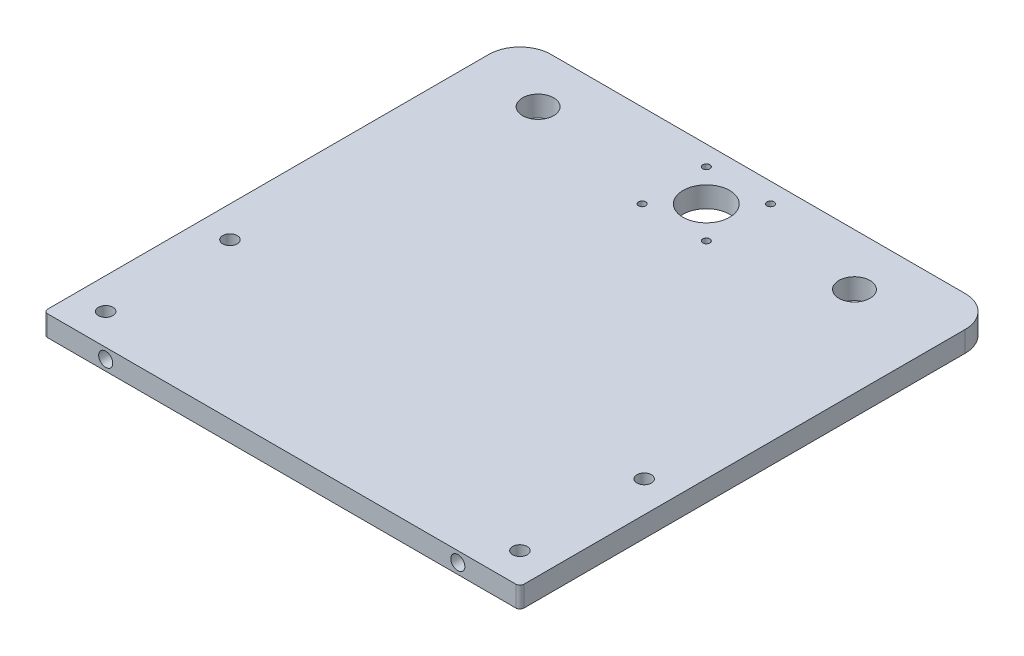
from build123d import *

# Parameters (mm, degrees)
SKIZZE1_W                                 = 230
SKIZZE1_H                                 = 230
AUFSATZ_LINEAR_AUSTRAGEN1_DEPTH           = 10
F_15_0_15_DURCHMESSER_BOHRUNG1_D          = 15
F_3_4_3_4_DURCHMESSER_BOHRUNG1_AT_2_COUNT = 2
F_3_4_3_4_DURCHMESSER_BOHRUNG1_AT_2_PITCH = 31
F_3_4_3_4_DURCHMESSER_BOHRUNG1_AT_3_COUNT = 2
F_3_4_3_4_DURCHMESSER_BOHRUNG1_AT_3_PITCH = 31
F_3_4_3_4_DURCHMESSER_BOHRUNG1_AT_4_COUNT = 2
F_3_4_3_4_DURCHMESSER_BOHRUNG1_AT_4_PITCH = 43.840620434
F_22_5_22_5_DURCHMESSER_BOHRUNG1_D        = 22.5
F_7_0_7_DURCHMESSER_BOHRUNG1_D            = 7
VERRUNDUNG5_R                             = 15
VERRUNDUNG6_R                             = 2
M8_GEWINDEBOHRUNG1_D                      = 6.8
M8_GEWINDEBOHRUNG1_DEPTH                  = 30
M8_GEWINDEBOHRUNG1_TIP                    = 2.042926105


with BuildPart() as part:
    # Skizze1 → Aufsatz-Linear austragen1 (new body)
    with BuildSketch(Plane(origin=(0, 0, 0), x_dir=(1, 0, 0), z_dir=(0, 1, 0))):
        Rectangle(SKIZZE1_W, SKIZZE1_H)
    extrude(amount=AUFSATZ_LINEAR_AUSTRAGEN1_DEPTH)

    # Ø15.0 (15) Durchmesser Bohrung1 (through all)
    with Locations(Plane(origin=(0, 10, 0), x_dir=(1, 0, 0), z_dir=(0, 1, 0))):
        with Locations((-81.223039609, 90), (71.525536654, 90)):
            Hole(F_15_0_15_DURCHMESSER_BOHRUNG1_D / 2)

    # Skizze9 → Ø3.4 (3.4) Durchmesser Bohrung1 (revolve, cut)
    with BuildSketch(Plane(origin=(-15.5, 10, -105.5), x_dir=(0, 0, 1), z_dir=(1, 0, 0))):
        Polygon((0, 0), (0, 10), (1.725, 10), (1.7, 9.975), (1.7, 0.025), (1.725, 0), align=None)
    f_3_4_3_4_durchmesser_bohrung1 = revolve(axis=Axis((-15.5, 16.35, -105.5), (0, -1, 0)), mode=Mode.SUBTRACT)

    # Ø3.4 (3.4) Durchmesser Bohrung1 at 2: Ø3.4 (3.4) Durchmesser Bohrung1 ×2
    with Locations(*[(i * F_3_4_3_4_DURCHMESSER_BOHRUNG1_AT_2_PITCH, 0, 0) for i in range(1, F_3_4_3_4_DURCHMESSER_BOHRUNG1_AT_2_COUNT)]):
        add(f_3_4_3_4_durchmesser_bohrung1, mode=Mode.SUBTRACT)

    # Ø3.4 (3.4) Durchmesser Bohrung1 at 3: Ø3.4 (3.4) Durchmesser Bohrung1 ×2
    with Locations(*[(0, 0, i * F_3_4_3_4_DURCHMESSER_BOHRUNG1_AT_3_PITCH) for i in range(1, F_3_4_3_4_DURCHMESSER_BOHRUNG1_AT_3_COUNT)]):
        add(f_3_4_3_4_durchmesser_bohrung1, mode=Mode.SUBTRACT)

    # Ø3.4 (3.4) Durchmesser Bohrung1 at 4: Ø3.4 (3.4) Durchmesser Bohrung1 ×2
    with Locations(*[Vector(0.7071067811865478, 0, 0.7071067811865474) * (i * F_3_4_3_4_DURCHMESSER_BOHRUNG1_AT_4_PITCH) for i in range(1, F_3_4_3_4_DURCHMESSER_BOHRUNG1_AT_4_COUNT)]):
        add(f_3_4_3_4_durchmesser_bohrung1, mode=Mode.SUBTRACT)

    # Ø22.5 (22.5) Durchmesser Bohrung1 (through all)
    with Locations(Plane(origin=(0, 10, 0), x_dir=(1, 0, 0), z_dir=(0, 1, 0))):
        with Locations((0, 90)):
            Hole(F_22_5_22_5_DURCHMESSER_BOHRUNG1_D / 2)

    # Ø7.0 (7) Durchmesser Bohrung1 (through all)
    with Locations(Plane(origin=(0, 10, 0), x_dir=(1, 0, 0), z_dir=(0, 1, 0))):
        with Locations((-100, -40), (-100, -100), (100, -40), (100, -100)):
            Hole(F_7_0_7_DURCHMESSER_BOHRUNG1_D / 2)

    # Verrundung5
    verrundung5_edges = [part.edges().sort_by_distance(p)[0] for p in [
        (115, 5, -115),
        (-115, 5, -115),
    ]]
    fillet(verrundung5_edges, radius=VERRUNDUNG5_R)

    # Verrundung6
    verrundung6_edges = [part.edges().sort_by_distance(p)[0] for p in [
        (115, 5, 115),
        (-115, 5, 115),
    ]]
    fillet(verrundung6_edges, radius=VERRUNDUNG6_R)

    # M8 Gewindebohrung1
    with Locations(Plane.XY.offset(115)):
        with Locations((-85, 5), (85, 5)):
            Hole(M8_GEWINDEBOHRUNG1_D / 2, depth=M8_GEWINDEBOHRUNG1_DEPTH)
            with Locations((0, 0, -(M8_GEWINDEBOHRUNG1_DEPTH + M8_GEWINDEBOHRUNG1_TIP / 2))):  # 118° drill point
                Cone(0, M8_GEWINDEBOHRUNG1_D / 2, M8_GEWINDEBOHRUNG1_TIP, mode=Mode.SUBTRACT)


solid = part.part
